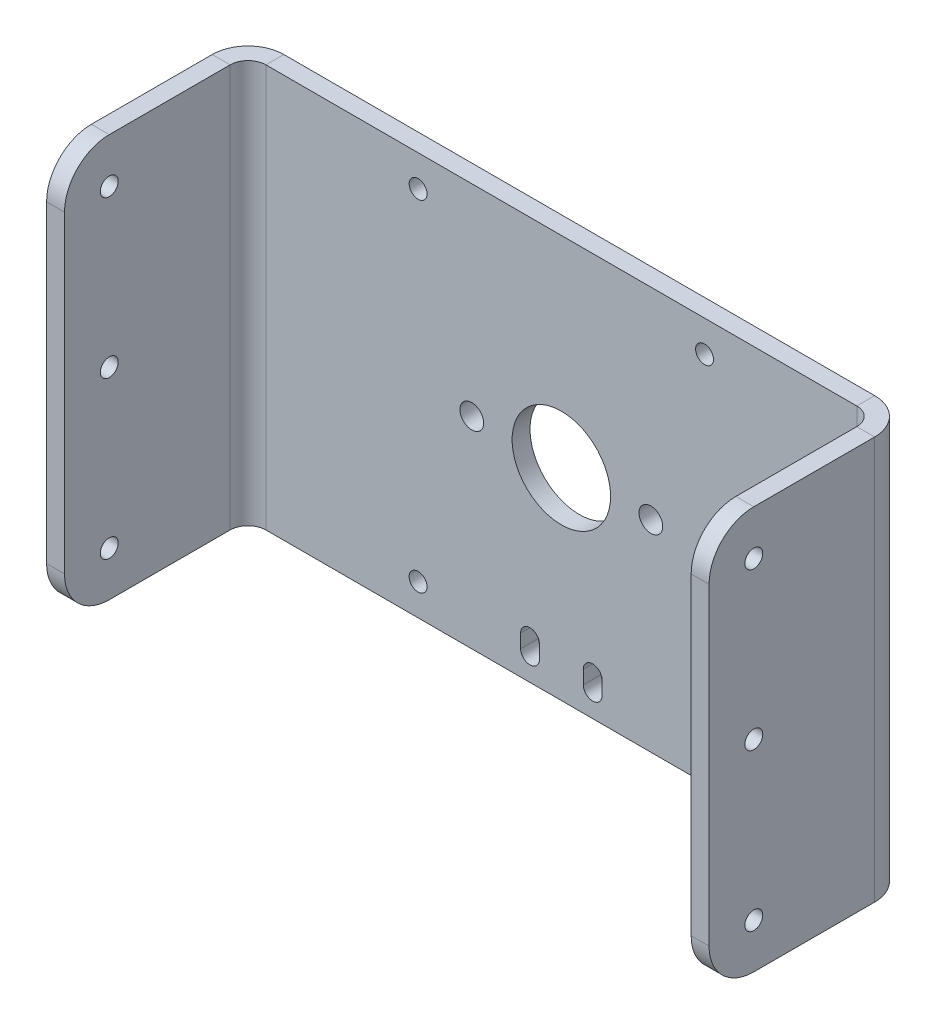
from build123d import *

# Parameters (mm, degrees)
SKETCH_1_W                         = 148
SKETCH_1_H                         = 90
SKETCH_1_R                         = 11
SKETCH_1_R_2                       = 2.65
SM_BASE_FLANGE_1_DEPTH             = 4
SM_EDGE_FLANGE_1_STRIP_W           = 24
SM_EDGE_FLANGE_1_STRIP_H           = 4
SM_EDGE_FLANGE_1_STRIP_CUT_DEPTH   = 90
SM_EDGE_FLANGE_1_STRIP_2_W         = 24
SM_EDGE_FLANGE_1_STRIP_2_H         = 4
SM_EDGE_FLANGE_1_STRIP_CUT_2_DEPTH = 90
SM_EDGE_FLANGE_1_DEPTH             = 90
SM_EDGE_FLANGE_1_BEND_DEPTH        = 90
SKETCH_12_R                        = 2
CUT_EXTRUDE_1_DEPTH                = 161.031246949
FILLET_1_R                         = 10
SKETCH_13_R                        = 2
CUT_EXTRUDE_2_DEPTH                = 96.822753039


# Sheet-metal steps are written as plain solids
with BuildPart() as part:
    # Sketch 1 → Базовая кромка1 (new body)
    with BuildSketch(Plane.XY):
        Rectangle(SKETCH_1_W, SKETCH_1_H)
        Circle(SKETCH_1_R, mode=Mode.SUBTRACT)
        with Locations((20, 0)):
            Circle(SKETCH_1_R_2, mode=Mode.SUBTRACT)
        with Locations((-20, 0)):
            Circle(SKETCH_1_R_2, mode=Mode.SUBTRACT)
        with BuildLine():
            Line((-4.9, -36.5), (-4.9, -39.5))
            ThreePointArc((-4.9, -39.5), (-7, -41.6), (-9.1, -39.5))
            Line((-9.1, -39.5), (-9.1, -36.5))
            ThreePointArc((-9.1, -36.5), (-7, -34.4), (-4.9, -36.5))
        make_face(mode=Mode.SUBTRACT)
        with BuildLine():
            Line((9.1, -36.5), (9.1, -39.5))
            ThreePointArc((9.1, -39.5), (7, -41.6), (4.9, -39.5))
            Line((4.9, -39.5), (4.9, -36.5))
            ThreePointArc((4.9, -36.5), (7, -34.4), (9.1, -36.5))
        make_face(mode=Mode.SUBTRACT)
    extrude(amount=-SM_BASE_FLANGE_1_DEPTH)

    # Ребро-кромка1 strip (across the edge) → Ребро-кромка1 strip cut (cut)
    with BuildSketch(Plane(origin=(-74, 45, 0), x_dir=(1, 0, 0), z_dir=(0, -1, 0))):
        with Locations((-4, -2)):
            Rectangle(SM_EDGE_FLANGE_1_STRIP_W, SM_EDGE_FLANGE_1_STRIP_H)
    extrude(amount=SM_EDGE_FLANGE_1_STRIP_CUT_DEPTH, mode=Mode.SUBTRACT)

    # Ребро-кромка1 strip 2 (across the edge) → Ребро-кромка1 strip cut 2 (cut)
    with BuildSketch(Plane(origin=(74, -45, 0), x_dir=(-1, 0, 0), z_dir=(0, 1, 0))):
        with Locations((-4, -2)):
            Rectangle(SM_EDGE_FLANGE_1_STRIP_2_W, SM_EDGE_FLANGE_1_STRIP_2_H)
    extrude(amount=SM_EDGE_FLANGE_1_STRIP_CUT_2_DEPTH, mode=Mode.SUBTRACT)

    # Ребро-кромка1 section (across the edge) → Ребро-кромка1 (add)
    with BuildSketch(Plane(origin=(-74, 45, 0), x_dir=(1, 0, 0), z_dir=(0, -1, 0))):
        with BuildLine():
            Line((0, 4), (0, 41))
            Line((0, 41), (4, 41))
            Line((4, 41), (4, 4))
            ThreePointArc((4, 4), (5.171572875, 1.171572875), (8, 0))
            Line((8, 0), (8, -4))
            ThreePointArc((8, -4), (2.343145751, -1.656854249), (0, 4))
        make_face()
    extrude(amount=SM_EDGE_FLANGE_1_DEPTH)

    # Ребро-кромка1 section 2 (across the edge) → Ребро-кромка1 bend (add)
    with BuildSketch(Plane(origin=(74, -45, 0), x_dir=(-1, 0, 0), z_dir=(0, 1, 0))):
        with BuildLine():
            Line((0, 4), (0, 41))
            Line((0, 41), (4, 41))
            Line((4, 41), (4, 4))
            ThreePointArc((4, 4), (5.171572875, 1.171572875), (8, 0))
            Line((8, 0), (8, -4))
            ThreePointArc((8, -4), (2.343145751, -1.656854249), (0, 4))
        make_face()
    extrude(amount=SM_EDGE_FLANGE_1_BEND_DEPTH)

    # Эскиз12 → Вырез-Вытянуть1 (cut, through all)
    with BuildSketch(Plane(origin=(74, 0, 0), x_dir=(0, 0, -1), z_dir=(1, 0, 0))):
        with Locations((-31, 35)):
            Circle(SKETCH_12_R)
        with Locations((-31, -35)):
            Circle(SKETCH_12_R)
        with Locations((-31, 0)):
            Circle(SKETCH_12_R)
    extrude(amount=-CUT_EXTRUDE_1_DEPTH, mode=Mode.SUBTRACT)

    # Скругление1
    fillet_1_edges = [part.edges().sort_by_distance(p)[0] for p in [
        (72, -45, 41),
        (72, 45, 41),
        (-72, 45, 41),
        (-72, -45, 41),
    ]]
    fillet(fillet_1_edges, radius=FILLET_1_R)

    # Эскиз13 → Вырез-Вытянуть2 (cut, through all)
    with BuildSketch(Plane.XY):
        with Locations((-32, 38)):
            Circle(SKETCH_13_R)
        with Locations((32, 38)):
            Circle(SKETCH_13_R)
        with Locations((32, -38)):
            Circle(SKETCH_13_R)
        with Locations((-32, -38)):
            Circle(SKETCH_13_R)
    extrude(amount=-CUT_EXTRUDE_2_DEPTH, mode=Mode.SUBTRACT)


solid = part.part
